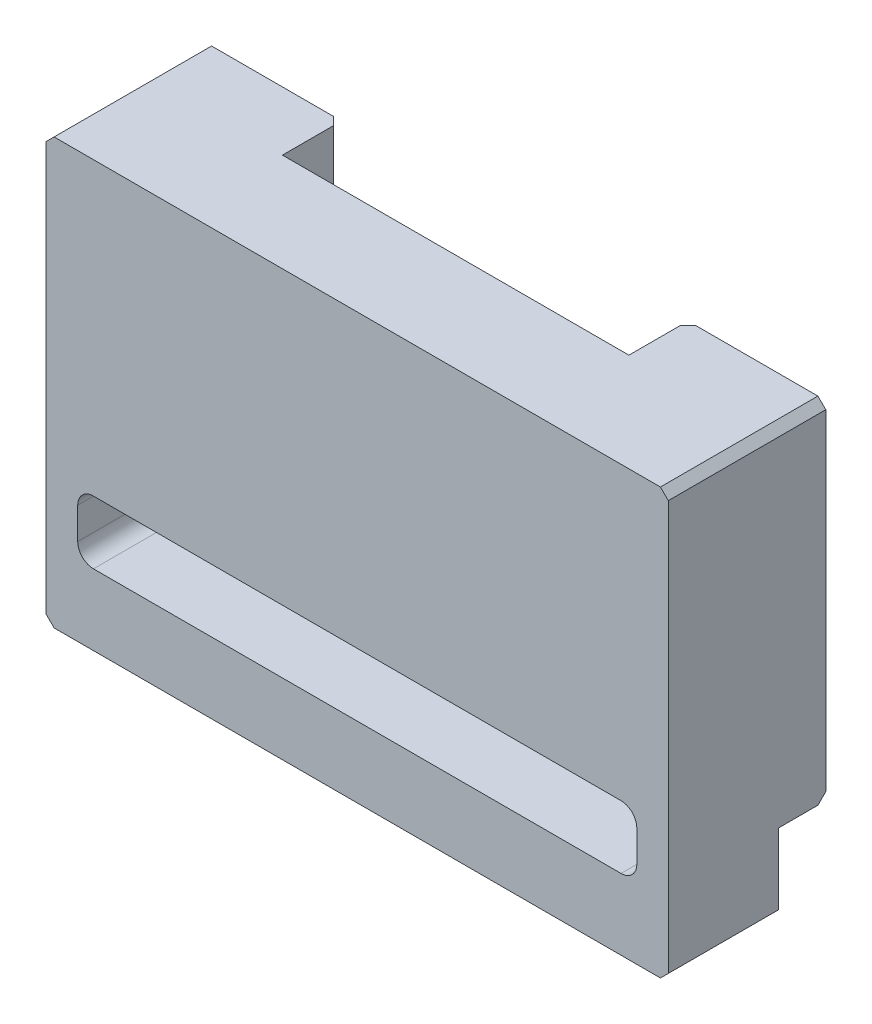
from build123d import *

# Parameters (mm, degrees)
BOSS_EXTRUDE1_DEPTH      = 5
BOSS_EXTRUDE1_DEPTH_BACK = 15
SKETCH1_W                = 79
SKETCH1_H                = 54
SKETCH3_W                = 79
SKETCH3_H                = 10
CUT_EXTRUDE1_DEPTH       = 1
SKETCH4_W                = 71
SKETCH4_H                = 8
CUT_EXTRUDE2_DEPTH       = 15
SKETCH5_W                = 44
SKETCH5_H                = 35
CUT_EXTRUDE3_DEPTH       = 2.5
SKETCH6_W                = 44
SKETCH6_H                = 2.5
CUT_EXTRUDE4_DEPTH       = 80.907759323
SKETCH7_W                = 71
SKETCH7_H                = 8
CUT_EXTRUDE5_DEPTH       = 80.285875161
SKETCH8_W                = 44
SKETCH8_H                = 37
CUT_EXTRUDE6_DEPTH       = 5
CUT_EXTRUDE7_DEPTH       = 5
FILLET1_R                = 2
CHAMFER2_SIZE            = 1
CHAMFER3_SIZE            = 1
CHAMFER4_SIZE            = 1


with BuildPart() as part:
    # Sketch1 → Boss-Extrude1 (new, two sides: drawn at the far end of the back side and taken through both)
    with BuildSketch(Plane.XY.offset(-BOSS_EXTRUDE1_DEPTH_BACK)):
        with Locations((-21, -22)):
            Rectangle(SKETCH1_W, SKETCH1_H)
    extrude(amount=BOSS_EXTRUDE1_DEPTH + BOSS_EXTRUDE1_DEPTH_BACK)

    # Sketch3 → Cut-Extrude1 (cut)
    with BuildSketch(Plane(origin=(0, 0, -15), x_dir=(-1, 0, 0), z_dir=(0, 0, -1))):
        with Locations((21, -44)):
            Rectangle(SKETCH3_W, SKETCH3_H)
    extrude(amount=-CUT_EXTRUDE1_DEPTH, mode=Mode.SUBTRACT)

    # Sketch4 → Cut-Extrude2 (cut)
    with BuildSketch(Plane(origin=(0, 0, -15), x_dir=(-1, 0, 0), z_dir=(0, 0, -1))):
        with Locations((21, -36)):
            Rectangle(SKETCH4_W, SKETCH4_H)
    extrude(amount=-CUT_EXTRUDE2_DEPTH, mode=Mode.SUBTRACT)

    # Sketch5 → Cut-Extrude3 (cut)
    with BuildSketch(Plane(origin=(0, 0, -15), x_dir=(-1, 0, 0), z_dir=(0, 0, -1))):
        with Locations((21, -16.5)):
            Rectangle(SKETCH5_W, SKETCH5_H)
    extrude(amount=-CUT_EXTRUDE3_DEPTH, mode=Mode.SUBTRACT)

    # Sketch6 → Cut-Extrude4 (cut, through all)
    with BuildSketch(Plane.XZ.offset(-1)):
        with Locations((-21, -13.75)):
            Rectangle(SKETCH6_W, SKETCH6_H)
    extrude(amount=-CUT_EXTRUDE4_DEPTH, mode=Mode.SUBTRACT)

    # Sketch7 → Cut-Extrude5 (cut, through all)
    with BuildSketch(Plane(origin=(0, 0, 0), x_dir=(-1, 0, 0), z_dir=(0, 0, -1))):
        with Locations((21, -36)):
            Rectangle(SKETCH7_W, SKETCH7_H)
    extrude(amount=-CUT_EXTRUDE5_DEPTH, mode=Mode.SUBTRACT)

    # Sketch8 → Cut-Extrude6 (cut)
    with BuildSketch(Plane(origin=(0, 0, -12.5), x_dir=(-1, 0, 0), z_dir=(0, 0, -1))):
        with Locations((21, -13.5)):
            Rectangle(SKETCH8_W, SKETCH8_H)
    extrude(amount=-CUT_EXTRUDE6_DEPTH, mode=Mode.SUBTRACT)

    # Sketch9 → Cut-Extrude7 (cut)
    with BuildSketch(Plane(origin=(0, 0, -14), x_dir=(-1, 0, 0), z_dir=(0, 0, -1))):
        Polygon((56.5, -40), (-14.5, -40), (-14.5, -39), (-18.5, -39), (-18.5, -49), (60.5, -49), (60.5, -39), (56.5, -39), align=None)
    extrude(amount=-CUT_EXTRUDE7_DEPTH, mode=Mode.SUBTRACT)

    # Fillet1
    fillet1_edges = [part.edges().sort_by_distance(p)[0] for p in [
        (14.5, -40, -2),
        (14.5, -32, -5),
        (-56.5, -32, -5),
        (-56.5, -40, -2),
    ]]
    fillet(fillet1_edges, radius=FILLET1_R)

    # Chamfer1
    # the kernel refuses this chamfer: 1, 0.732050808 mm, written as the material it takes off along each edge
    with BuildSketch(Plane(origin=(14.232050808, -39, -9), x_dir=(0.9974998388550008, -0.07066874474792476, 0), z_dir=(0, 0, -1))) as chamfer1_piece_1:
        with BuildLine():
            Line((0.534510572, 0), (0.183539981, -0.816493036))
            Line((0.183539981, -0.816493036), (0.163562724, -0.817446573))
            ThreePointArc((0.163562724, -0.817446573), (0.12384643, -0.40032394), (-0.017983891, -0.00875098))
            Line((-0.017983891, -0.00875098), (0.001413375, 0.019949997))
            ThreePointArc((0.001413375, 0.019949997), (0.267333969, 0.001110621), (0.535923947, 0.019949997))
            Line((0.535923947, 0.019949997), (0.534510572, 0))
        make_face()
    extrude(amount=8.092169631, mode=Mode.SUBTRACT)
    with BuildSketch(Plane(origin=(-56.232050808, -39, -17.092169631), x_dir=(-0.2877176347633081, 0.9577152826629675, 0), z_dir=(0, 0, 1))) as chamfer1_piece_2:
        with BuildLine():
            Line((0.836867853, 0), (0.11722766, 0.521497102))
            Line((0.11722766, 0.521497102), (0.098073354, 0.527251455))
            ThreePointArc((0.098073354, 0.527251455), (0.057547506, 0.261068897), (-0.019154306, 0.005754353))
            Line((-0.019154306, 0.005754353), (0.004593737, -0.019465292))
            ThreePointArc((0.004593737, -0.019465292), (0.417739168, 0.033033052), (0.833416807, -0.019700007))
            Line((0.833416807, -0.019700007), (0.836867853, 0))
        make_face()
    extrude(amount=8.092169631, mode=Mode.SUBTRACT)

    # Chamfer2
    chamfer2_edges = [part.edges().sort_by_distance(p)[0] for p in [
        (1, -13.5, -15),
        (-43, -13.5, -15),
    ]]
    chamfer(chamfer2_edges, length=CHAMFER2_SIZE)

    # Chamfer3
    chamfer3_edges = [part.edges().sort_by_distance(p)[0] for p in [
        (18.5, -49, -2),
        (-60.5, -49, -2),
        (-60.5, 5, -5),
        (18.5, 5, -5),
    ]]
    chamfer(chamfer3_edges, length=CHAMFER3_SIZE)

    # Chamfer4
    chamfer4_edges = [part.edges().sort_by_distance(p)[0] for p in [
        (-58.626032501, -39, -15),
        (16.626032501, -39, -15),
    ]]
    chamfer(chamfer4_edges, length=CHAMFER4_SIZE)


solid = part.part
